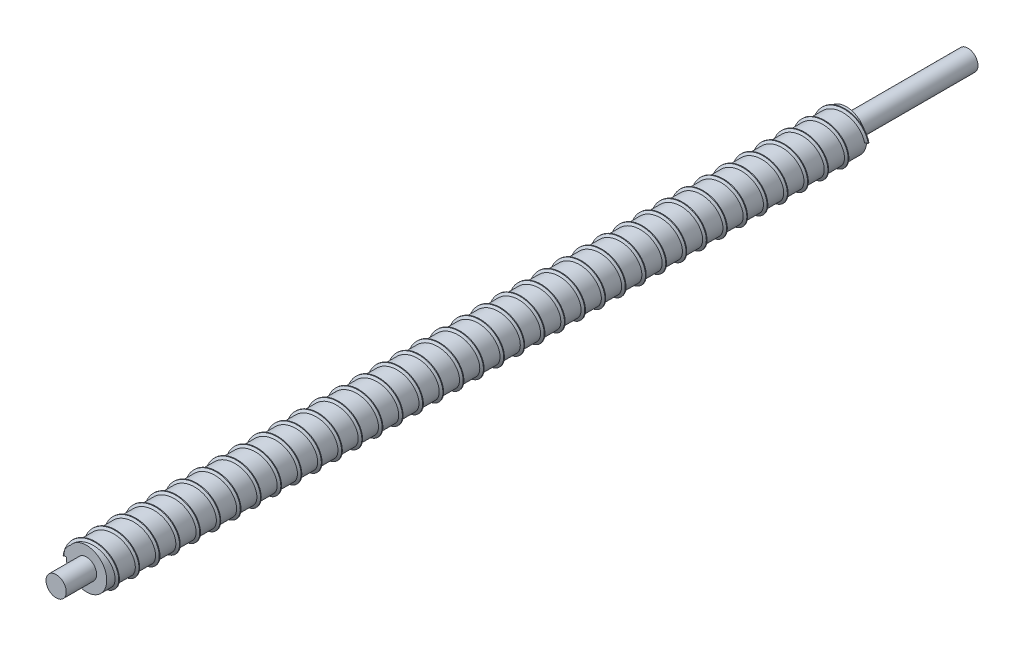
from build123d import *

# Parameters (mm, degrees)
SKETCH1_R           = 10
BOSS_EXTRUDE1_DEPTH = 450
CUT_EXTRUDE1_START  = -15
SKETCH2_R           = 10
SKETCH2_R_2         = 5
CUT_EXTRUDE1_DEPTH  = 15
SKETCH3_R           = 10
SKETCH3_R_2         = 5
CUT_EXTRUDE2_DEPTH  = 60
SWEEP2_PITCH        = 10
SKETCH9_R           = 11.113126631
SKETCH9_R_2         = 5
CUT_EXTRUDE3_DEPTH  = 10


with BuildPart() as part:
    # Sketch1 → Boss-Extrude1 (new body)
    with BuildSketch(Plane.XY):
        Circle(SKETCH1_R)
    extrude(amount=BOSS_EXTRUDE1_DEPTH)

    # Sketch2 → Cut-Extrude1 (cut)
    with BuildSketch(Plane.XY.offset(450).offset(CUT_EXTRUDE1_START)):
        Circle(SKETCH2_R)
        Circle(SKETCH2_R_2, mode=Mode.SUBTRACT)
    extrude(amount=CUT_EXTRUDE1_DEPTH, mode=Mode.SUBTRACT)

    # Sketch3 → Cut-Extrude2 (cut)
    with BuildSketch(Plane(origin=(0, 0, 0), x_dir=(-1, 0, 0), z_dir=(0, 0, -1))):
        Circle(SKETCH3_R)
        with Locations(Location((0, 0, 0), (0, 0, 180))):
            Circle(SKETCH3_R_2, mode=Mode.SUBTRACT)
    extrude(amount=-CUT_EXTRUDE2_DEPTH, mode=Mode.SUBTRACT)

    # Sweep2: arcs per turn and ends read off the stored shape
    # Sweep2: the profile of Sketch8 screwed along a right-hand helix through 37.5 turns, 16 arcs to a turn; built about Z, then put on its axis
    sweep2_z = Axis((0, 0, 0), (0, 0, 1))
    sweep2_corners = [(9.107433068, 0, 0), (11.148656095, 0, 0), (11.148656095, 0, -0.367470612), (9.107433068, 0, -1.545971276)]
    with BuildLine(mode=Mode.PRIVATE) as sweep2_profile:
        Line(sweep2_corners[0], sweep2_corners[1])
        Line(sweep2_corners[1], sweep2_corners[2])
        Line(sweep2_corners[2], sweep2_corners[3])
        Line(sweep2_corners[3], sweep2_corners[0])
    sweep2_cap = Face(sweep2_profile.wire())
    sweep2_turn_angles = [0, 11.25, 22.5, 33.75, 45, 56.25, 67.5, 78.75, 90, 101.25, 112.5, 123.75, 135, 146.25, 157.5, 168.75, 180, 191.25, 202.5, 213.75, 225, 236.25, 247.5, 258.75, 270, 281.25, 292.5, 303.75, 315, 326.25, 337.5, 348.75, 360]
    sweep2_turn_weights = [1, 0.9807852804032304, 1, 0.9807852804032304, 1, 0.9807852804032304, 1, 0.9807852804032304, 1, 0.9807852804032304, 1, 0.9807852804032304, 1, 0.9807852804032304, 1, 0.9807852804032304, 1, 0.9807852804032304, 1, 0.9807852804032304, 1, 0.9807852804032304, 1, 0.9807852804032304, 1, 0.9807852804032304, 1, 0.9807852804032304, 1, 0.9807852804032304, 1, 0.9807852804032304, 1]
    sweep2_turn_rails = [Edge.make_bspline([Vector(p[0], p[1], 0).rotate(sweep2_z, sweep2_turn_angles[k]) / sweep2_turn_weights[k] + Vector(0, 0, p[2] + SWEEP2_PITCH * sweep2_turn_angles[k] / 360) for k in range(33)], [0, 0, 0, 1, 1, 2, 2, 3, 3, 4, 4, 5, 5, 6, 6, 7, 7, 8, 8, 9, 9, 10, 10, 11, 11, 12, 12, 13, 13, 14, 14, 15, 15, 16, 16, 16], 2, sweep2_turn_weights) for p in sweep2_corners]
    sweep2_turn_sides = [Face.make_surface_from_curves(sweep2_turn_rails[p[0]], sweep2_turn_rails[p[1]]) for p in [(0, 1), (1, 2), (2, 3), (3, 0)]]
    sweep2_last_angles = [13320, 13331.25, 13342.5, 13353.75, 13365, 13376.25, 13387.5, 13398.75, 13410, 13421.25, 13432.5, 13443.75, 13455, 13466.25, 13477.5, 13488.75, 13500]
    sweep2_last_weights = [1, 0.9807852804032304, 1, 0.9807852804032304, 1, 0.9807852804032304, 1, 0.9807852804032304, 1, 0.9807852804032304, 1, 0.9807852804032304, 1, 0.9807852804032304, 1, 0.9807852804031035, 1]
    sweep2_last_rails = [Edge.make_bspline([Vector(p[0], p[1], 0).rotate(sweep2_z, sweep2_last_angles[k]) / sweep2_last_weights[k] + Vector(0, 0, p[2] + SWEEP2_PITCH * sweep2_last_angles[k] / 360) for k in range(17)], [0, 0, 0, 1, 1, 2, 2, 3, 3, 4, 4, 5, 5, 6, 6, 7, 7, 8, 8, 8], 2, sweep2_last_weights) for p in sweep2_corners]
    sweep2_last_sides = [Face.make_surface_from_curves(sweep2_last_rails[p[0]], sweep2_last_rails[p[1]]) for p in [(0, 1), (1, 2), (2, 3), (3, 0)]]
    sweep2 = Plane(origin=(0, 0, 435), x_dir=(-1, 0, 0), z_dir=(0, 0, -1)) * Solid(Shell([*[p.moved(Location((0, 0, SWEEP2_PITCH * i))) for i in range(37) for p in sweep2_turn_sides], *sweep2_last_sides, sweep2_cap, sweep2_cap.rotate(sweep2_z, 13500).moved(Location((0, 0, SWEEP2_PITCH * 13500 / 360)))]))
    add(sweep2)

    # Sketch9 → Cut-Extrude3 (cut)
    with BuildSketch(Plane.XY.offset(435)):
        Circle(SKETCH9_R)
        Circle(SKETCH9_R_2, mode=Mode.SUBTRACT)
    extrude(amount=CUT_EXTRUDE3_DEPTH, mode=Mode.SUBTRACT)


solid = part.part
